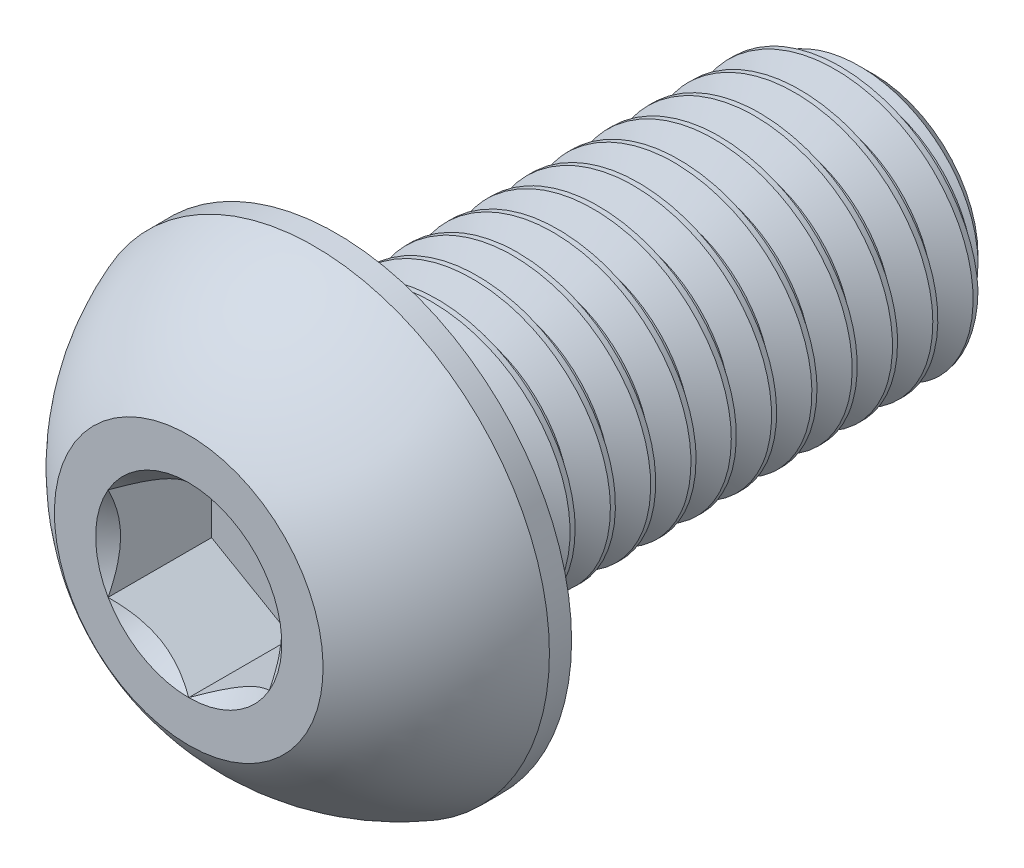
from build123d import *

# Parameters (mm, degrees)
CUT_EXTRUDE2_DEPTH = 3.85
CUT_SWEEP2_PITCH   = 1.5
CUT_SWEEP2_TO      = 20


with BuildPart() as part:
    # Sketch10 → Revolve3 (revolve)
    with BuildSketch(Plane(origin=(0, 0, 0), x_dir=(0, 0, -1), z_dir=(1, 0, 0)), mode=Mode.PRIVATE) as revolve3_sk:
        Polygon((24.375, 5), (25.5, 3.875), (25.5, 0), (5.5, 0), (5.5, 5), align=None)
    revolve(revolve3_sk.sketch.rotate(Axis((0, 0, 0), (0, 0, -1)), 90), axis=Axis((0, 0, 0), (0, 0, -1)))

    # Sketch7 → Revolve2 (revolve)
    with BuildSketch(Plane(origin=(0, 0, 0), x_dir=(0, 0, -1), z_dir=(1, 0, 0)), mode=Mode.PRIVATE) as revolve2_sk:
        with BuildLine():
            Line((4.675, 8.75), (5.5, 8.75))
            Line((5.5, 8.75), (5.5, 0))
            Line((5.5, 0), (0, 0))
            Line((0, 0), (0, 5))
            ThreePointArc((0, 5), (2.027465032, 7.26151026), (4.675, 8.75))
        make_face()
    revolve(revolve2_sk.sketch.rotate(Axis((0, 0, 0), (0, 0, -1)), 180), axis=Axis((0, 0, 0), (0, 0, -1)))

    # Sketch5 → Cut-Extrude2 (cut)
    with BuildSketch(Plane.XY):
        Polygon((3, -1.732050808), (3, 1.732050808), (0, 3.464101615), (-3, 1.732050808), (-3, -1.732050808), (0, -3.464101615), align=None)
    extrude(amount=-CUT_EXTRUDE2_DEPTH, mode=Mode.SUBTRACT)

    # Cut-Extrude3 cone 1 section (through the dimple's axis) → Cut-Extrude3 (revolve, cut)
    with BuildSketch(Plane(origin=(0, 0, 0), x_dir=(0, -1, 0), z_dir=(1, 0, 0))):
        Polygon((0, 0), (3.464101615, 0), (0, 3.464101615), align=None)
    revolve(axis=Axis((0, 0, 0), (0, 0, -1)), mode=Mode.SUBTRACT)


with BuildPart() as body_2:
    # Split1: read off the stored shape, not the designer's step
    # Split1: the piece on the far side of the plane
    add(part.part)
    split(bisect_by=Plane.XY.offset(-5.5), keep=Keep.BOTTOM)

    # Cut-Sweep2: arcs per turn and ends read off the stored shape
    # Cut-Sweep2: the profile of Sketch12 screwed along a right-hand helix through 18 turns, 8 arcs to a turn; built about Z, then put on its axis
    cut_sweep2_z = Axis((0, 0, 0), (0, 0, 1))
    cut_sweep2_corners = [(4.025721421, 0, -0.5625), (4.025721421, 0, -0.75), (5.081189882, 0, -1.359375), (5.081189882, 0, 0.046875)]
    with BuildLine(mode=Mode.PRIVATE) as cut_sweep2_profile:
        Line(cut_sweep2_corners[0], cut_sweep2_corners[1])
        Line(cut_sweep2_corners[1], cut_sweep2_corners[2])
        Line(cut_sweep2_corners[2], cut_sweep2_corners[3])
        Line(cut_sweep2_corners[3], cut_sweep2_corners[0])
    cut_sweep2_cap = Face(cut_sweep2_profile.wire())
    cut_sweep2_turn_angles = [0, 22.5, 45, 67.5, 90, 112.5, 135, 157.5, 180, 202.5, 225, 247.5, 270, 292.5, 315, 337.5, 360]
    cut_sweep2_turn_weights = [1, 0.9238795325112867, 1, 0.9238795325112867, 1, 0.9238795325112867, 1, 0.9238795325112867, 1, 0.9238795325112867, 1, 0.9238795325112867, 1, 0.9238795325112867, 1, 0.9238795325112867, 1]
    cut_sweep2_turn_rails = [Edge.make_bspline([Vector(p[0], p[1], 0).rotate(cut_sweep2_z, cut_sweep2_turn_angles[k]) / cut_sweep2_turn_weights[k] + Vector(0, 0, p[2] + CUT_SWEEP2_PITCH * cut_sweep2_turn_angles[k] / 360) for k in range(17)], [0, 0, 0, 1, 1, 2, 2, 3, 3, 4, 4, 5, 5, 6, 6, 7, 7, 8, 8, 8], 2, cut_sweep2_turn_weights) for p in cut_sweep2_corners]
    cut_sweep2_turn_sides = [Face.make_surface_from_curves(cut_sweep2_turn_rails[p[0]], cut_sweep2_turn_rails[p[1]]) for p in [(0, 1), (1, 2), (2, 3), (3, 0)]]
    cut_sweep2 = Plane(origin=(0, 0, -25.5), x_dir=(0, 1, 0), z_dir=(0, 0, 1)) * split(Solid(Shell([*[p.moved(Location((0, 0, CUT_SWEEP2_PITCH * i))) for i in range(18) for p in cut_sweep2_turn_sides], cut_sweep2_cap, cut_sweep2_cap.rotate(cut_sweep2_z, 6480).moved(Location((0, 0, CUT_SWEEP2_PITCH * 6480 / 360)))])), bisect_by=Plane.XY.offset(CUT_SWEEP2_TO), keep=Keep.BOTTOM, mode=Mode.PRIVATE)
    add(cut_sweep2, mode=Mode.SUBTRACT)


with BuildPart() as part_1:
    add(part.part)

    # Split1
    split(bisect_by=Plane.XY.offset(-5.5), keep=Keep.TOP)

    add(body_2.part)  # Boss-Extrude1 merges body 2
    # Boss-Extrude1: read off the stored shape, not the designer's step
    # Boss-Extrude1 outline → Boss-Extrude1 (revolve)
    with BuildSketch(Plane.XZ):
        Polygon((4.025721421, -5.5), (4.025721421, -6.474278579), (5, -5.5), align=None)
    revolve(axis=Axis((0, 0, 0), (0, 0, 1)))


solid = part_1.part
